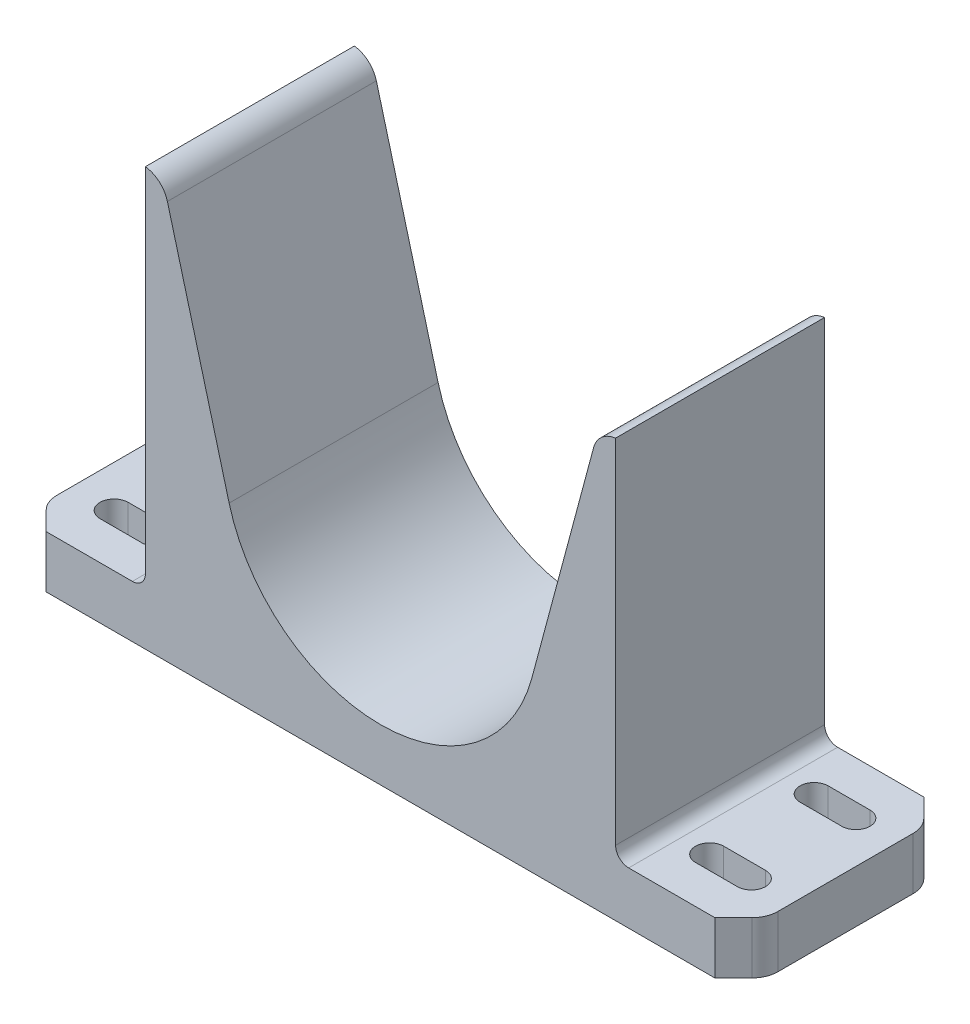
from build123d import *

# Parameters (mm, degrees)
BOSS_EXTRUDE1_DEPTH = 50.8
SKETCH2_W           = 30.48
SKETCH2_H           = 50.8
BOSS_EXTRUDE2_DEPTH = 12.7
FILLET1_R           = 3.175
CHAMFER1_SIZE       = 6.35
FILLET2_R           = 6.35
FILLET3_R           = 6.35


with BuildPart() as part:
    # Sketch1 → Boss-Extrude1 (new body)
    with BuildSketch(Plane.XY):
        with BuildLine():
            Line((-36.801773982, 137.346090308), (-53.055841449, 198.007095926))
            Line((-53.055841449, 198.007095926), (-57.15, 198.007095926))
            Line((-57.15, 198.007095926), (-57.15, 96.407095926))
            Line((-57.15, 96.407095926), (57.15, 96.407095926))
            Line((57.15, 96.407095926), (57.15, 198.007095926))
            Line((57.15, 198.007095926), (53.055841449, 198.007095926))
            Line((53.055841449, 198.007095926), (36.801773982, 137.346090308))
            ThreePointArc((36.801773982, 137.346090308), (0, 109.107095926), (-36.801773982, 137.346090308))
        make_face()
    extrude(amount=BOSS_EXTRUDE1_DEPTH)

    # Sketch2 → Boss-Extrude2 (add)
    # profile 1 of 2: a face of its own
    with BuildSketch(Plane.XZ.offset(-96.407095926)):
        with Locations((-72.39, 25.4)):
            Rectangle(SKETCH2_W, SKETCH2_H)
        with BuildLine():
            Line((-77.47, 16.129), (-67.31, 16.129))
            ThreePointArc((-67.31, 16.129), (-63.881, 12.7), (-67.31, 9.271))
            Line((-67.31, 9.271), (-77.47, 9.271))
            ThreePointArc((-77.47, 9.271), (-80.899, 12.7), (-77.47, 16.129))
        make_face(mode=Mode.SUBTRACT)
        with BuildLine():
            Line((-77.47, 34.671), (-67.31, 34.671))
            ThreePointArc((-67.31, 34.671), (-63.881, 38.1), (-67.31, 41.529))
            Line((-67.31, 41.529), (-77.47, 41.529))
            ThreePointArc((-77.47, 41.529), (-80.899, 38.1), (-77.47, 34.671))
        make_face(mode=Mode.SUBTRACT)
    # profile 2 of 2: a face of its own
    with BuildSketch(Plane.XZ.offset(-96.407095926)):
        with Locations((72.39, 25.4)):
            Rectangle(SKETCH2_W, SKETCH2_H)
        with BuildLine():
            Line((77.47, 34.671), (67.31, 34.671))
            ThreePointArc((67.31, 34.671), (63.881, 38.1), (67.31, 41.529))
            Line((67.31, 41.529), (77.47, 41.529))
            ThreePointArc((77.47, 41.529), (80.899, 38.1), (77.47, 34.671))
        make_face(mode=Mode.SUBTRACT)
        with BuildLine():
            Line((77.47, 16.129), (67.31, 16.129))
            ThreePointArc((67.31, 16.129), (63.881, 12.7), (67.31, 9.271))
            Line((67.31, 9.271), (77.47, 9.271))
            ThreePointArc((77.47, 9.271), (80.899, 12.7), (77.47, 16.129))
        make_face(mode=Mode.SUBTRACT)
    extrude(amount=-BOSS_EXTRUDE2_DEPTH)

    # Fillet1
    fillet1_edges = [part.edges().sort_by_distance(p)[0] for p in [
        (-57.15, 109.107095926, 25.4),
        (57.15, 109.107095926, 25.4),
    ]]
    fillet(fillet1_edges, radius=FILLET1_R)

    # Chamfer1
    chamfer1_edges = [part.edges().sort_by_distance(p)[0] for p in [
        (-87.63, 102.757095926, 0),
        (-87.63, 102.757095926, 50.8),
        (87.63, 102.757095926, 0),
        (87.63, 102.757095926, 50.8),
    ]]
    chamfer(chamfer1_edges, length=CHAMFER1_SIZE)

    # Fillet2
    fillet2_edges = [part.edges().sort_by_distance(p)[0] for p in [
        (87.63, 102.757095926, 6.35),
        (87.63, 102.757095926, 44.45),
        (-87.63, 102.757095926, 44.45),
        (-87.63, 102.757095926, 6.35),
    ]]
    fillet(fillet2_edges, radius=FILLET2_R)

    # Fillet3
    # the kernel refuses this fillet: 6.35 mm, written as the material it takes off along each edge
    with BuildSketch(Plane(origin=(53.055841449, 198.007095926, -12.053098402), x_dir=(-0.2588190451025212, -0.9659258262890681, 0), z_dir=(0, 0, 1))) as fillet3_piece_1:
        with BuildLine():
            CenterArc((4.821239361, 6.35), FILLET3_R, 202.161584325, 67.838415675)
            Line((-1.059646207, 3.954653481), (-1.177263918, 3.906746551))
            ThreePointArc((-1.177263918, 3.906746551), (-0.652495683, 1.944456722), (-0.12267258, -0.032870019))
            Line((-0.12267258, -0.032870019), (0, -0.127))
            Line((0, -0.127), (4.821239361, -0.127))
            Line((4.821239361, -0.127), (4.821239361, 0))
        make_face()
    extrude(amount=74.906196803, mode=Mode.SUBTRACT)
    with BuildSketch(Plane(origin=(-53.055841449, 198.007095926, -12.053098402), x_dir=(-1, 0, 0), z_dir=(0, 0, 1))) as fillet3_piece_2:
        with BuildLine():
            CenterArc((4.885800429, 6.30046055), FILLET3_R, 195, 67.838415675)
            Line((-1.247828568, 4.656959613), (-1.370501147, 4.624089594))
            Line((-1.370501147, 4.624089594), (-0.12267258, -0.032870019))
            Line((-0.12267258, -0.032870019), (0, -0.127))
            ThreePointArc((0, -0.127), (2.047079275, -0.127), (4.078325713, -0.126009211))
            Line((4.078325713, -0.126009211), (4.094158551, 0))
        make_face()
    extrude(amount=74.906196803, mode=Mode.SUBTRACT)


solid = part.part
